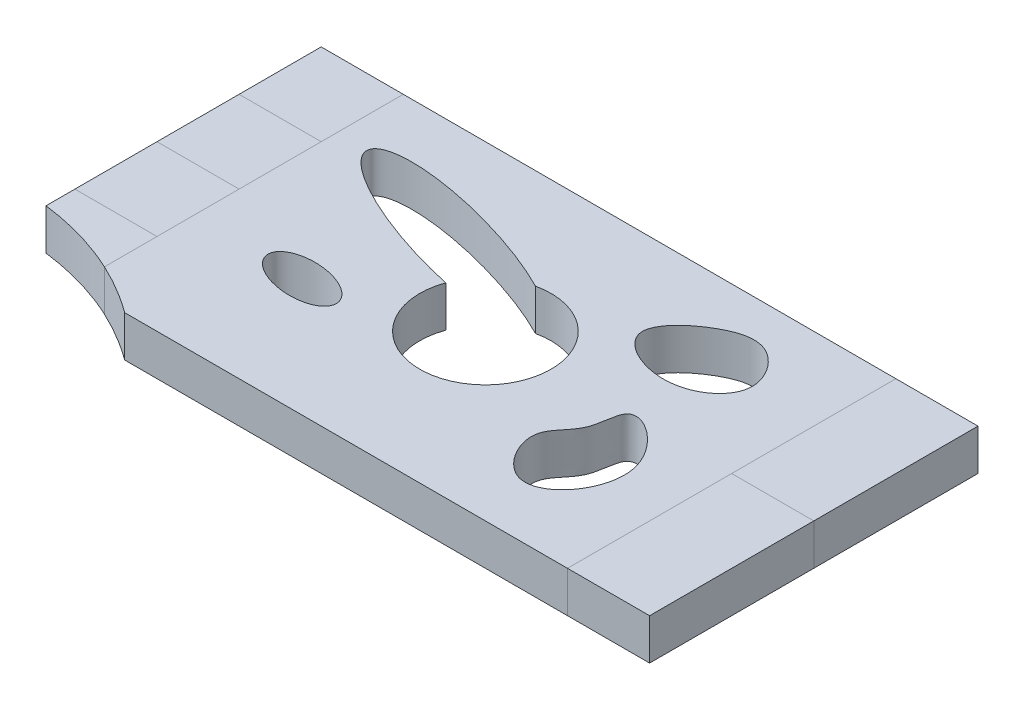
from build123d import *

# Parameters (mm, degrees)
SKETCH1_W           = 38.1
SKETCH1_H           = 25.4
SKETCH1_R           = 5.08
BOSS_EXTRUDE1_DEPTH = 3.175
SKETCH2_W           = 6.35
SKETCH2_H           = 3.175
BOSS_EXTRUDE3_DEPTH = 6.35
SKETCH2_4_W         = 6.35
SKETCH2_4_H         = 3.175
BOSS_EXTRUDE4_DEPTH = 6.35
SKETCH2_6_W         = 6.35
SKETCH2_6_H         = 3.175
BOSS_EXTRUDE6_DEPTH = 6.35
SKETCH2_7_W         = 6.35
SKETCH2_7_H         = 3.175
BOSS_EXTRUDE7_DEPTH = 6.35
SKETCH4_W           = 12.7
SKETCH4_H           = 3.175
BOSS_EXTRUDE8_DEPTH = 6.35
SKETCH4_3_W         = 12.7
SKETCH4_3_H         = 3.175
BOSS_EXTRUDE9_DEPTH = 6.35
CUT_EXTRUDE26_START = -3.175
CUT_EXTRUDE26_DEPTH = 3.175
SKETCH20_RX         = 3.004459521
SKETCH20_RY         = 1.558481615
CUT_EXTRUDE30_DEPTH = 29.575000153
CUT_EXTRUDE31_DEPTH = 29.575000153
SKETCH21_RX         = 9.834488757
SKETCH21_RY         = 2.394817115
CUT_EXTRUDE32_DEPTH = 29.575000153
CUT_EXTRUDE33_DEPTH = 29.57500022


# Read off the part's stored shape, not the designer's step: Cut-Extrude26
with BuildPart() as part:
    # Sketch1 → Boss-Extrude1 (new body)
    with BuildSketch(Plane(origin=(0, 0, 0), x_dir=(1, 0, 0), z_dir=(0, 1, 0))):
        Rectangle(SKETCH1_W, SKETCH1_H)
        with Locations(Location((0, 0, 0), (0, 0, 270))):
            Circle(SKETCH1_R, mode=Mode.SUBTRACT)
    extrude(amount=BOSS_EXTRUDE1_DEPTH)


with BuildPart() as body_2:
    # Sketch2 → Boss-Extrude3 (new body)
    with BuildSketch(Plane.ZY.offset(19.05)):
        with Locations((-9.525, 1.5875)):
            Rectangle(SKETCH2_W, SKETCH2_H)
    extrude(amount=BOSS_EXTRUDE3_DEPTH)


with BuildPart() as body_3:
    # Sketch2<4> → Boss-Extrude4 (new body)
    with BuildSketch(Plane.ZY.offset(19.05)):
        with Locations((-3.175, 1.5875)):
            Rectangle(SKETCH2_4_W, SKETCH2_4_H)
    extrude(amount=BOSS_EXTRUDE4_DEPTH)


with BuildPart() as body_4:
    # Sketch2<6> → Boss-Extrude6 (new body)
    with BuildSketch(Plane.ZY.offset(19.05)):
        with Locations((3.175, 1.5875)):
            Rectangle(SKETCH2_6_W, SKETCH2_6_H)
    extrude(amount=BOSS_EXTRUDE6_DEPTH)


with BuildPart() as body_5:
    # Sketch2<7> → Boss-Extrude7 (new body)
    with BuildSketch(Plane.ZY.offset(19.05)):
        with Locations((9.525, 1.5875)):
            Rectangle(SKETCH2_7_W, SKETCH2_7_H)
    extrude(amount=BOSS_EXTRUDE7_DEPTH)


with BuildPart() as body_6:
    # Sketch4 → Boss-Extrude8 (new body)
    with BuildSketch(Plane(origin=(19.05, 0, 0), x_dir=(0, 0, -1), z_dir=(1, 0, 0))):
        with Locations((-6.35, 1.5875)):
            Rectangle(SKETCH4_W, SKETCH4_H)
    extrude(amount=BOSS_EXTRUDE8_DEPTH)


with BuildPart() as body_7:
    # Sketch4<3> → Boss-Extrude9 (new body)
    with BuildSketch(Plane(origin=(19.05, 0, 0), x_dir=(0, 0, -1), z_dir=(1, 0, 0))):
        with Locations((6.35, 1.5875)):
            Rectangle(SKETCH4_3_W, SKETCH4_3_H)
    extrude(amount=BOSS_EXTRUDE9_DEPTH)


with BuildPart() as cut_extrude26_tool:
    # Cut-Extrude26 outline → Cut-Extrude26 (new body)
    with BuildSketch(Plane(origin=(0, 3.175, 0), x_dir=(1, 0, 0), z_dir=(0, 1, 0)).offset(CUT_EXTRUDE26_START)):
        with BuildLine():
            Line((-25.40000001, -8.584161711), (-25.4, -12.7))
            Line((-25.4, -12.7), (-15.195735819, -12.7))
            add(Edge.make_bspline(
                [(-15.195735819, -12.7), (-19.896484417, -9.275242159), (-25.40000001, -8.584161711)],
                knots=[0.629884856, 0.629884856, 0.629884856, 1.343767888, 1.343767888, 1.343767888], degree=2))
        make_face()
    extrude(amount=CUT_EXTRUDE26_DEPTH)


with BuildPart() as part_1:
    add(part.part)

    # Cut-Extrude26: cut by cut_extrude26_tool
    add(cut_extrude26_tool.part, mode=Mode.SUBTRACT)

    # Sketch20 → Cut-Extrude30 (cut, through all)
    with BuildSketch(Plane(origin=(0, 3.175, 0), x_dir=(1, 0, 0), z_dir=(0, 1, 0))):
        with Locations(Location((-10.598682853, -3.572248522), (0, 0, -8.820379552))):
            Ellipse(SKETCH20_RX, SKETCH20_RY)
    extrude(amount=-CUT_EXTRUDE30_DEPTH, mode=Mode.SUBTRACT)

    # Sketch18 → Cut-Extrude31 (cut, through all)
    with BuildSketch(Plane(origin=(0, 3.175, 0), x_dir=(1, 0, 0), z_dir=(0, 1, 0))):
        with BuildLine():
            add(Edge.make_bspline(
                [(8.89707251, -4.729765561), (9.131509688, -3.916570321), (10.738548368, -2.859569013), (10.487378328, 1.696754067), (17.502350701, -3.445877025), (11.594859569, -11.232638154), (8.510073602, -6.072153622), (8.89707251, -4.729765561)],
                knots=[0, 0, 0, 0, 0.126992451, 0.245733089, 0.477340126, 0.790366271, 1, 1, 1, 1], degree=3))
        make_face()
    extrude(amount=-CUT_EXTRUDE31_DEPTH, mode=Mode.SUBTRACT)

    # Sketch21 → Cut-Extrude32 (cut, through all)
    with BuildSketch(Plane(origin=(0, 3.175, 0), x_dir=(1, 0, 0), z_dir=(0, 1, 0))):
        with Locations(Location((-7.260829298, 4.832030762), (0, 0, 163.072486936))):
            Ellipse(SKETCH21_RX, SKETCH21_RY)
    extrude(amount=-CUT_EXTRUDE32_DEPTH, mode=Mode.SUBTRACT)

    # Sketch23 → Cut-Extrude33 (cut, through all)
    with BuildSketch(Plane(origin=(0, 3.175, 0), x_dir=(1, 0, 0), z_dir=(0, 1, 0))):
        with BuildLine():
            add(Edge.make_bspline(
                [(6.084779473, 5.956947977), (5.988800305, 7.019640943), (8.360613638, 9.276299903), (12.16405117, 10.45489234), (15.257834124, 6.071463409), (10.610458282, 2.538680826), (6.206679233, 4.607259091), (6.084779473, 5.956947977)],
                knots=[0, 0, 0, 0, 0.192637987, 0.357007452, 0.539778503, 0.755337281, 1, 1, 1, 1], degree=3))
        make_face()
    extrude(amount=-CUT_EXTRUDE33_DEPTH, mode=Mode.SUBTRACT)


with BuildPart() as body_5_1:
    add(body_5.part)

    # Cut-Extrude26: cut by cut_extrude26_tool
    add(cut_extrude26_tool.part, mode=Mode.SUBTRACT)


solid = Compound([body_2.part, body_3.part, body_4.part, body_6.part, body_7.part, part_1.part, body_5_1.part])
